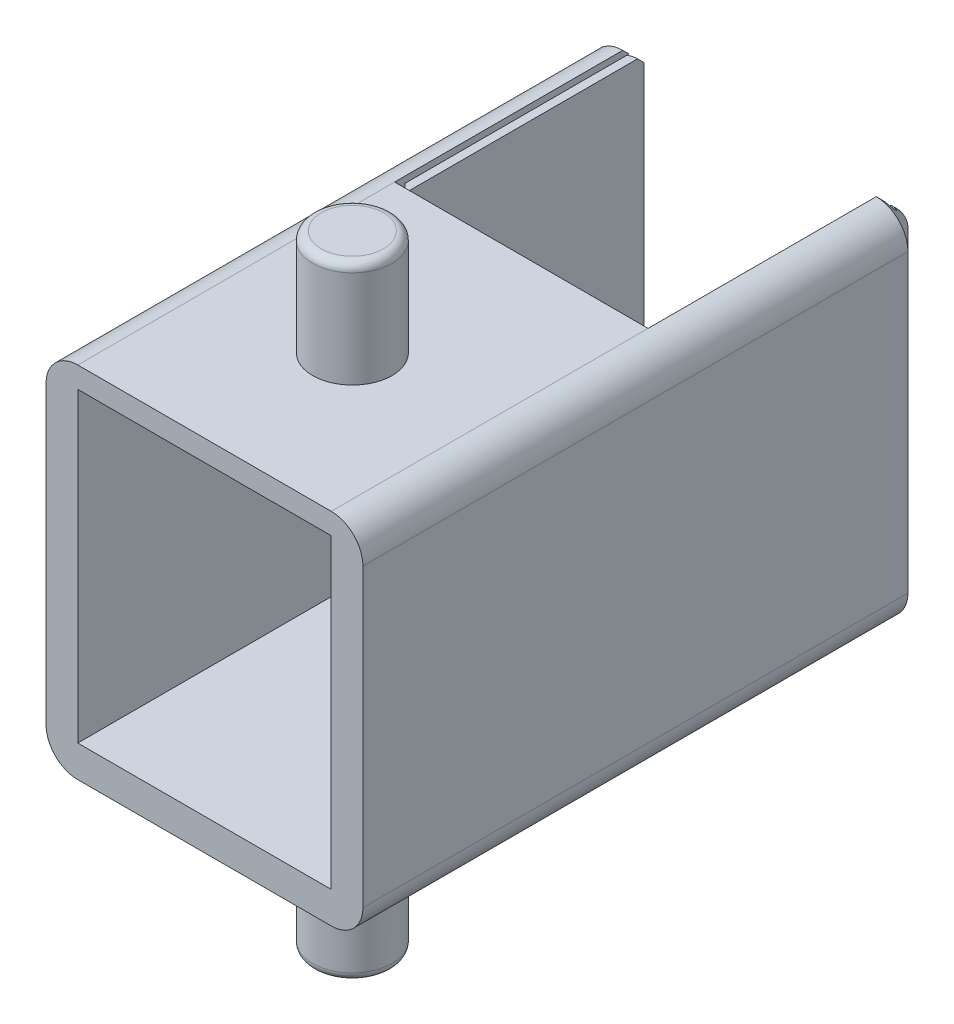
from build123d import *

# Parameters (mm, degrees)
BOSS_EXTRUDE1_DEPTH = 69.85
CUT_EXTRUDE1_DEPTH  = 50.8
SKETCH3_R           = 1.27
SKETCH3_R_2         = 3.81
CUT_EXTRUDE2_DEPTH  = 50.8
SKETCH4_W           = 30.48
SKETCH4_H           = 38.1
BOSS_EXTRUDE2_DEPTH = 2.54
SKETCH5_W           = 30.48
SKETCH5_H           = 1.016
CUT_EXTRUDE3_DEPTH  = 1.016
FILLET1_R           = 3.81
SKETCH6_R           = 4.7625
BOSS_EXTRUDE3_DEPTH = 12.7
BOSS_EXTRUDE4_START = 19.05
SKETCH8_R           = 4.7625
BOSS_EXTRUDE4_DEPTH = 19.05
FILLET2_R           = 1.016
SKETCH9_W           = 38.1
SKETCH9_H           = 43.18
CUT_EXTRUDE4_DEPTH  = 2.032


# Some blends are built 0.0001 mm under size
with BuildPart() as part:
    # Sketch1 → Boss-Extrude1 (new body)
    with BuildSketch(Plane.XY):
        Polygon((15.24, -19.685), (-15.24, -19.685), (-15.24, 19.685), (-19.05, 19.685), (-19.05, -23.495), (15.24, -23.495), (19.05, -23.495), (19.05, 19.685), (15.24, 19.685), align=None)
    extrude(amount=BOSS_EXTRUDE1_DEPTH)

    # Sketch2 → Cut-Extrude1 (cut)
    with BuildSketch(Plane(origin=(0, 19.685, 0), x_dir=(1, 0, 0), z_dir=(0, 1, 0))):
        with BuildLine():
            Line((-19.05, 0), (19.05, 0))
            ThreePointArc((19.05, 0), (0, -2.54), (-19.05, 0))
        make_face()
    extrude(amount=-CUT_EXTRUDE1_DEPTH, mode=Mode.SUBTRACT)

    # Sketch3 → Cut-Extrude2 (cut)
    with BuildSketch(Plane(origin=(0, 19.685, 0), x_dir=(1, 0, 0), z_dir=(0, 1, 0))):
        with Locations(Location((-11.176, -5.842, 0), (0, 0, 270))):
            Circle(SKETCH3_R)
        with Locations(Location((11.176, -5.842, 0), (0, 0, 270))):
            Circle(SKETCH3_R)
        with Locations(Location((11.176, -28.194, 0), (0, 0, 270))):
            Circle(SKETCH3_R)
        with Locations(Location((-11.176, -28.194, 0), (0, 0, 270))):
            Circle(SKETCH3_R)
        with Locations(Location((0, -17.018, 0), (0, 0, 270))):
            Circle(SKETCH3_R_2)
    extrude(amount=-CUT_EXTRUDE2_DEPTH, mode=Mode.SUBTRACT)

    # Sketch4 → Boss-Extrude2 (add)
    with BuildSketch(Plane(origin=(0, 19.685, 0), x_dir=(1, 0, 0), z_dir=(0, 1, 0))):
        with Locations((0, -50.8)):
            Rectangle(SKETCH4_W, SKETCH4_H)
    extrude(amount=-BOSS_EXTRUDE2_DEPTH)

    # Sketch5 → Cut-Extrude3 (cut)
    with BuildSketch(Plane(origin=(-15.24, 0, 0), x_dir=(0, 0, -1), z_dir=(1, 0, 0))):
        with Locations((-15.24, 18.415)):
            Rectangle(SKETCH5_W, SKETCH5_H)
    cut_extrude3 = extrude(amount=-CUT_EXTRUDE3_DEPTH, mode=Mode.SUBTRACT)

    # Mirror1: Cut-Extrude3 across plane
    add(cut_extrude3.mirror(Plane(origin=(0, 0, 0), x_dir=(0, 0, 1), z_dir=(1, 0, 0))), mode=Mode.SUBTRACT)

    # Fillet1
    fillet1_edges = [part.edges().sort_by_distance(p)[0] for p in [
        (19.05, 19.685, 34.925),
        (19.05, -23.495, 34.925),
        (-19.05, -23.495, 34.925),
        (-19.05, 19.685, 34.925),
    ]]
    fillet(fillet1_edges, radius=FILLET1_R - 0.0001)  # a hair under: the kernel refuses the full size

    # Sketch6 → Boss-Extrude3 (add)
    with BuildSketch(Plane(origin=(0, 19.685, 0), x_dir=(1, 0, 0), z_dir=(0, 1, 0))):
        with Locations((0, -52.07)):
            Circle(SKETCH6_R)
    extrude(amount=BOSS_EXTRUDE3_DEPTH)

    # Sketch8 → Boss-Extrude4 (add)
    with BuildSketch(Plane.XZ.offset(23.495).offset(BOSS_EXTRUDE4_START)):
        with Locations((0, 52.07)):
            Circle(SKETCH8_R)
    extrude(amount=-BOSS_EXTRUDE4_DEPTH)

    # Fillet2
    fillet2_edges = [part.edges().sort_by_distance(p)[0] for p in [
        (-4.7625, 32.385, 52.07),
        (-4.7625, -42.545, 52.07),
    ]]
    fillet(fillet2_edges, radius=FILLET2_R)

    # Sketch9 → Cut-Extrude4 (cut)
    with BuildSketch(Plane(origin=(0, 0, 1.778), x_dir=(-1, 0, 0), z_dir=(0, 0, -1))):
        with Locations((0, -1.905)):
            Rectangle(SKETCH9_W, SKETCH9_H)
    extrude(amount=CUT_EXTRUDE4_DEPTH, mode=Mode.SUBTRACT)

    # Chamfer1
    # the kernel refuses this chamfer: 2.54 mm, written as the material it takes off along each edge
    with BuildSketch(Plane(origin=(-15.2401, 15.8751, 1.778), x_dir=(0, 1, 0), z_dir=(1, 0, 0))) as chamfer1_piece_1:
        with BuildLine():
            Line((1.198057951, -0.071842049), (3.881742049, 2.611842049))
            Line((3.881742049, 2.611842049), (3.932542049, 2.611842049))
            ThreePointArc((3.932542049, 2.611842049), (3.8607, 1.305921024), (3.8607, 0))
            Line((3.8607, 0), (3.8099, -0.0508))
            ThreePointArc((3.8099, -0.0508), (2.503978976, -0.0508), (1.198057951, -0.122642049))
            Line((1.198057951, -0.122642049), (1.198057951, -0.071842049))
        make_face()
    revolve(axis=Axis((-15.2401, 15.8751, 1.778), (0, 0, 1)), revolution_arc=90, mode=Mode.SUBTRACT)
    with BuildSketch(Plane(origin=(-15.2401, -19.6851, 1.778), x_dir=(-1, 0, 0), z_dir=(0, 1, 0))) as chamfer1_piece_2:
        with BuildLine():
            Line((3.881742049, 2.611842049), (1.198057951, -0.071842049))
            Line((1.198057951, -0.071842049), (1.198057951, -0.122642049))
            ThreePointArc((1.198057951, -0.122642049), (2.503978976, -0.0508), (3.8099, -0.0508))
            Line((3.8099, -0.0508), (3.8607, 0))
            ThreePointArc((3.8607, 0), (3.8607, 1.305921024), (3.932542049, 2.611842049))
            Line((3.932542049, 2.611842049), (3.881742049, 2.611842049))
        make_face()
    revolve(axis=Axis((-15.2401, -19.6851, 1.778), (0, 0, 1)), revolution_arc=90, mode=Mode.SUBTRACT)
    with BuildSketch(Plane(origin=(-19.05, 15.8751, 1.778), x_dir=(1, 0, 0), z_dir=(0, -1, 0)), Plane(origin=(19.05, -19.6851, 1.778), x_dir=(-1, 0, 0), z_dir=(0, 1, 0))) as chamfer1_piece_3:
        with BuildLine():
            Line((2.611842049, -0.071842049), (-0.071842049, 2.611842049))
            Line((-0.071842049, 2.611842049), (-0.122642049, 2.611842049))
            ThreePointArc((-0.122642049, 2.611842049), (-0.0508, 1.305921024), (-0.0508, 0))
            Line((-0.0508, 0), (0, -0.0508))
            ThreePointArc((0, -0.0508), (1.305921024, -0.0508), (2.611842049, -0.122642049))
            Line((2.611842049, -0.122642049), (2.611842049, -0.071842049))
        make_face()
    extrude(amount=35.5602, mode=Mode.SUBTRACT)
    with BuildSketch(Plane(origin=(-5.17814213, -23.495, 1.778), x_dir=(0, 0, 1), z_dir=(1, 0, 0)), Plane(origin=(-15.2401, -23.495, 1.778), x_dir=(0, 0, 1), z_dir=(1, 0, 0))) as chamfer1_piece_4:
        with BuildLine():
            Line((2.611842049, 0.071842049), (-0.071842049, -2.611842049))
            Line((-0.071842049, -2.611842049), (-0.122642049, -2.611842049))
            ThreePointArc((-0.122642049, -2.611842049), (-0.0508, -1.305921024), (-0.0508, 0))
            Line((-0.0508, 0), (0, 0.0508))
            ThreePointArc((0, 0.0508), (1.305921024, 0.0508), (2.611842049, 0.122642049))
            Line((2.611842049, 0.122642049), (2.611842049, 0.071842049))
        make_face()
    extrude(amount=20.41824213, mode=Mode.SUBTRACT)
    with BuildSketch(Plane(origin=(15.2401, 15.8751, 1.778), x_dir=(1, 0, 0), z_dir=(0, -1, 0))) as chamfer1_piece_5:
        with BuildLine():
            Line((1.198057951, -0.071842049), (3.881742049, 2.611842049))
            Line((3.881742049, 2.611842049), (3.932542049, 2.611842049))
            ThreePointArc((3.932542049, 2.611842049), (3.8607, 1.305921024), (3.8607, 0))
            Line((3.8607, 0), (3.8099, -0.0508))
            ThreePointArc((3.8099, -0.0508), (2.503978976, -0.0508), (1.198057951, -0.122642049))
            Line((1.198057951, -0.122642049), (1.198057951, -0.071842049))
        make_face()
    revolve(axis=Axis((15.2401, 15.8751, 1.778), (0, 0, 1)), revolution_arc=90, mode=Mode.SUBTRACT)
    with BuildSketch(Plane(origin=(15.2401, -19.6851, 1.778), x_dir=(0, -1, 0), z_dir=(-1, 0, 0))) as chamfer1_piece_6:
        with BuildLine():
            Line((1.198057951, -0.071842049), (3.881742049, 2.611842049))
            Line((3.881742049, 2.611842049), (3.932542049, 2.611842049))
            ThreePointArc((3.932542049, 2.611842049), (3.8607, 1.305921024), (3.8607, 0))
            Line((3.8607, 0), (3.8099, -0.0508))
            ThreePointArc((3.8099, -0.0508), (2.503978976, -0.0508), (1.198057951, -0.122642049))
            Line((1.198057951, -0.122642049), (1.198057951, -0.071842049))
        make_face()
    revolve(axis=Axis((15.2401, -19.6851, 1.778), (0, 0, 1)), revolution_arc=90, mode=Mode.SUBTRACT)
    with BuildSketch(Plane(origin=(15.2401, 19.685, 1.778), x_dir=(0, -1, 0), z_dir=(-1, 0, 0)), Plane(origin=(0.436979495, 19.685, 1.778), x_dir=(0, -1, 0), z_dir=(-1, 0, 0))) as chamfer1_piece_7:
        with BuildLine():
            Line((2.611842049, -0.071842049), (-0.071842049, 2.611842049))
            Line((-0.071842049, 2.611842049), (-0.122642049, 2.611842049))
            ThreePointArc((-0.122642049, 2.611842049), (-0.0508, 1.305921024), (-0.0508, 0))
            Line((-0.0508, 0), (0, -0.0508))
            ThreePointArc((0, -0.0508), (1.305921024, -0.0508), (2.611842049, -0.122642049))
            Line((2.611842049, -0.122642049), (2.611842049, -0.071842049))
        make_face()
    extrude(amount=15.677079495, mode=Mode.SUBTRACT)


solid = part.part
